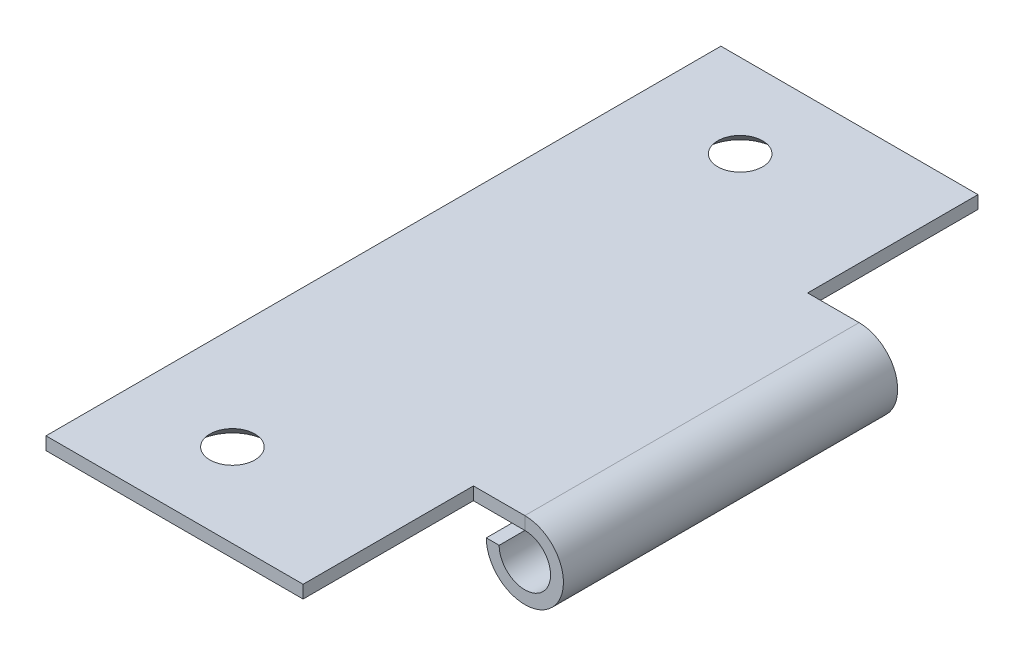
from build123d import *

# Parameters (mm, degrees)
BASE_FLANGE1_DEPTH                                = 1
HEM1_START                                        = -13.232002457
HEM1_DEPTH                                        = 26
CSK_FOR_M2_5_OVAL_HEAD_MACHINE_SCREW1_D           = 3.1
CSK_FOR_M2_5_OVAL_HEAD_MACHINE_SCREW1_DEPTH       = 4
CSK_FOR_M2_5_OVAL_HEAD_MACHINE_SCREW1_CSINK_D     = 5.5
CSK_FOR_M2_5_OVAL_HEAD_MACHINE_SCREW1_CSINK_ANGLE = 90
CSK_FOR_M2_5_OVAL_HEAD_MACHINE_SCREW1_TIP         = 0.931333959


# Read off the part's stored shape, not the designer's step: Hem1
# Sheet-metal steps are written as plain solids
with BuildPart() as part:
    # Sketch1 → Base-Flange1 (new body)
    with BuildSketch(Plane(origin=(0, 0, 0), x_dir=(1, 0, 0), z_dir=(0, 1, 0))):
        Polygon((6.794487322, 26.482002457), (-13.205512678, 26.482002457), (-13.205512678, -26.017997543), (6.794487322, -26.017997543), (6.794487322, -12.767997543), (10.794487322, -12.767997543), (10.794487322, 13.232002457), (6.794487322, 13.232002457), align=None)
    extrude(amount=-BASE_FLANGE1_DEPTH)

    # Hem1 outline → Hem1 (add)
    with BuildSketch(Plane.XY.offset(HEM1_START)):
        with BuildLine():
            Line((8.794487322, -3), (7.794487322, -3))
            ThreePointArc((7.794487322, -3), (12.915807666, -5.121320344), (10.794487322, 0))
            Line((10.794487322, 0), (10.794487322, -1))
            ThreePointArc((10.794487322, -1), (12.208700884, -4.414213562), (8.794487322, -3))
        make_face()
    extrude(amount=HEM1_DEPTH)

    # CSK for M2.5 Oval Head Machine Screw1
    with Locations(Plane(origin=(-5.205512678, -1, -19.982002457), x_dir=(0, 0, -1), z_dir=(0, -1, 0))):
        with Locations((0, 0), (-39.5, 0)):
            CounterSinkHole(CSK_FOR_M2_5_OVAL_HEAD_MACHINE_SCREW1_D / 2, CSK_FOR_M2_5_OVAL_HEAD_MACHINE_SCREW1_CSINK_D / 2, depth=CSK_FOR_M2_5_OVAL_HEAD_MACHINE_SCREW1_DEPTH, counter_sink_angle=CSK_FOR_M2_5_OVAL_HEAD_MACHINE_SCREW1_CSINK_ANGLE)
            with Locations((0, 0, -(CSK_FOR_M2_5_OVAL_HEAD_MACHINE_SCREW1_DEPTH + CSK_FOR_M2_5_OVAL_HEAD_MACHINE_SCREW1_TIP / 2))):  # 118° drill point
                Cone(0, CSK_FOR_M2_5_OVAL_HEAD_MACHINE_SCREW1_D / 2, CSK_FOR_M2_5_OVAL_HEAD_MACHINE_SCREW1_TIP, mode=Mode.SUBTRACT)


solid = part.part
